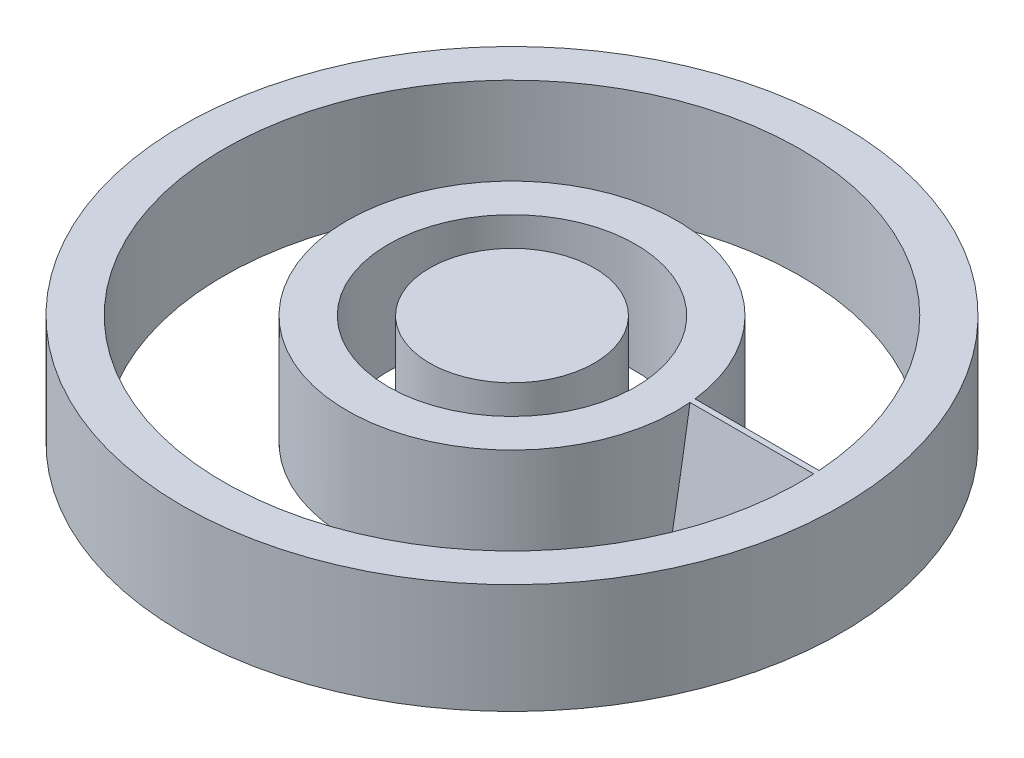
from build123d import *
from build123d.topology import SkipClean

# Parameters (mm, degrees)
SKETCH1_R             = 7.5
BOSS_EXTRUDE1_DEPTH   = 10
SKETCH1_R_2           = 15
SKETCH1_R_3           = 11.25
BOSS_EXTRUDE1_2_DEPTH = 10
SKETCH1_R_4           = 30
SKETCH1_R_5           = 26.25
BOSS_EXTRUDE1_3_DEPTH = 10
BOSS_EXTRUDE2_START   = 7.289779118
BOSS_EXTRUDE2_DEPTH   = 18.960220882
SKETCH10_W            = 3.75
SKETCH10_H            = 10


# Read off the part's stored shape, not the designer's step: Boss-Extrude2
with BuildPart() as part:
    # Sketch1 → Boss-Extrude1 (new body)
    with BuildSketch(Plane(origin=(0, 0, 0), x_dir=(1, 0, 0), z_dir=(0, 1, 0))):
        with Locations(Location((0, 0, 0), (0, 0, 270))):
            Circle(SKETCH1_R)
    extrude(amount=BOSS_EXTRUDE1_DEPTH)



with BuildPart() as body_2:
    # Sketch1 → Boss-Extrude1 2 (new body)
    with BuildSketch(Plane(origin=(0, 0, 0), x_dir=(1, 0, 0), z_dir=(0, 1, 0))):
        with Locations(Location((0, 0, 0), (0, 0, 270))):
            Circle(SKETCH1_R_2)
        with Locations(Location((0, 0, 0), (0, 0, 270))):
            Circle(SKETCH1_R_3, mode=Mode.SUBTRACT)
    extrude(amount=BOSS_EXTRUDE1_2_DEPTH)


with BuildPart() as body_3:
    # Sketch1 → Boss-Extrude1 3 (new body)
    with BuildSketch(Plane(origin=(0, 0, 0), x_dir=(1, 0, 0), z_dir=(0, 1, 0))):
        with Locations(Location((0, 0, 0), (0, 0, 270))):
            Circle(SKETCH1_R_4)
        with Locations(Location((0, 0, 0), (0, 0, 270))):
            Circle(SKETCH1_R_5, mode=Mode.SUBTRACT)
    extrude(amount=BOSS_EXTRUDE1_3_DEPTH)


with BuildPart() as part_1:
    add(part.part)

    add(body_2.part)  # Boss-Extrude2 merges body 2

    add(body_3.part)  # Boss-Extrude2 merges body 3
    # Boss-Extrude2 outline → Boss-Extrude2 (add)
    with BuildSketch(Plane(origin=(0, 0, 0), x_dir=(0, 0, -1), z_dir=(1, 0, 0)).offset(BOSS_EXTRUDE2_START)):
        Polygon((0, 0), (1.763269807, 10), (1.255556501, 10), (-0.507713306, 0), align=None)
    extrude(amount=BOSS_EXTRUDE2_DEPTH)

    # Sketch10 → Cut-Revolve1 (revolve, cut)
    with SkipClean():  # the faces are left unmerged after this step: merging them gives an invalid solid
        with BuildSketch(Plane.XY):
            with Locations((9.375, 5)):
                Rectangle(SKETCH10_W, SKETCH10_H)
        revolve(axis=Axis((0, 85.419330933, 0), (0, -1, 0)), mode=Mode.SUBTRACT)
    add(part_1.part.scale(1), mode=Mode.REPLACE)  # the faces are merged on a copy


with BuildPart() as cut_revolve1_piece_1:
    # of the separate pieces the step leaves, piece 1, a body of its own (cut_revolve1_pieces)
    add(part_1.part.solids().sort_by_distance((0, 0, 11.25))[0])


with BuildPart() as cut_revolve1_piece_2:
    # of the separate pieces the step leaves, piece 2, a body of its own (cut_revolve1_pieces)
    add(part_1.part.solids().sort_by_distance((0, 0, 7.5))[0])


solid = Compound([cut_revolve1_piece_1.part, cut_revolve1_piece_2.part])
